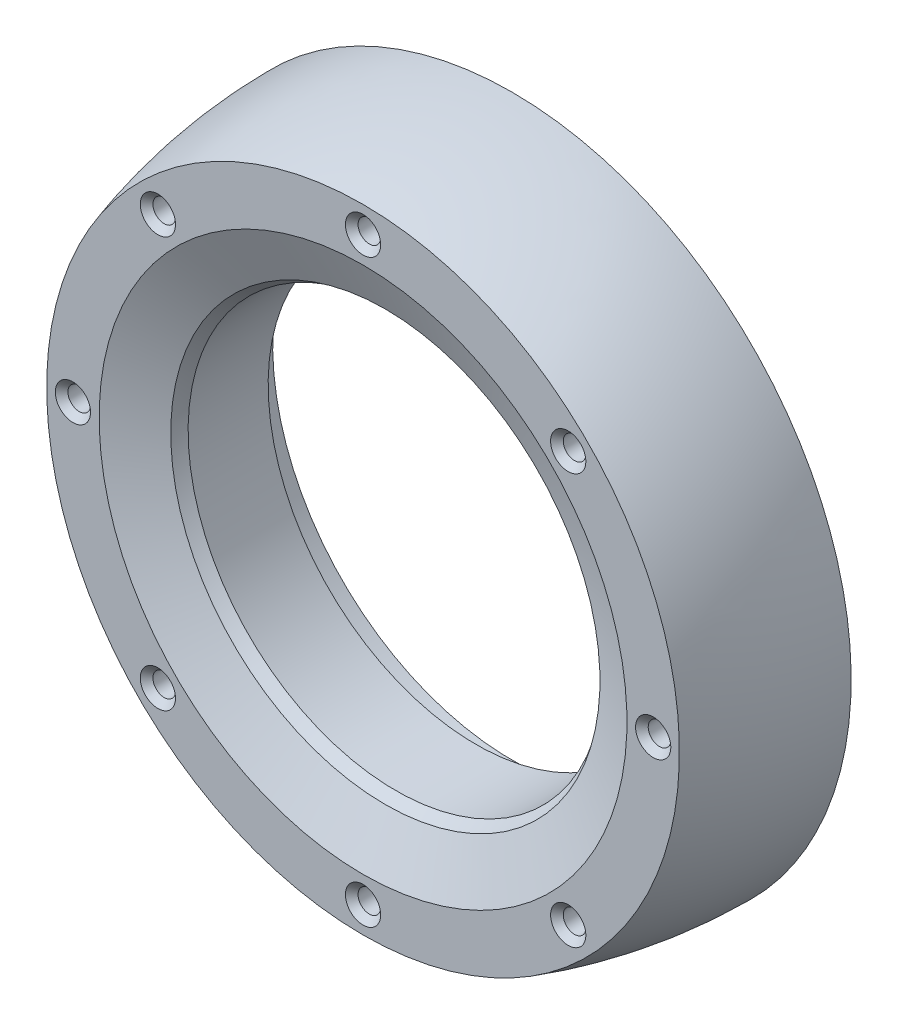
from build123d import *

# Parameters (mm, degrees)
FASE1_SIZE                                           = 4.290340475
SKIZZE11_R                                           = 22.5
SCHNITT_LINEAR_AUSTRAGEN3_DEPTH                      = 56.540525909
FORMSENKUNG_F_R_M3_SENKSCHRAUBE_MIT_INNE_D           = 1.6
FORMSENKUNG_F_R_M3_SENKSCHRAUBE_MIT_INNE_DEPTH       = 22
FORMSENKUNG_F_R_M3_SENKSCHRAUBE_MIT_INNE_CSINK_D     = 3.9
FORMSENKUNG_F_R_M3_SENKSCHRAUBE_MIT_INNE_CSINK_ANGLE = 90
FORMSENKUNG_F_R_M3_SENKSCHRAUBE_MIT_INNE_TIP         = 0.480688495
SKIZZE10_R                                           = 1.25
SCHNITT_LINEAR_AUSTRAGEN2_DEPTH                      = 56.540525909


with BuildPart() as part:
    # Skizze1 → Rotation (revolve)
    with BuildSketch(Plane(origin=(0, 0, 0), x_dir=(0, 0, -1), z_dir=(1, 0, 0))):
        with BuildLine():
            Line((0, 26), (0, 37.5))
            ThreePointArc((0, 37.5), (-8.344159634, 36.871453585), (-16.5, 35))
            Line((-16.5, 35), (-16.5, 24.905973721))
            ThreePointArc((-16.5, 24.905973721), (-12.407631733, 22.680062235), (-9.073139558, 19.426860442))
            Line((-9.073139558, 19.426860442), (-6, 22.5))
            Line((-6, 22.5), (-4, 22.5))
            Line((-4, 22.5), (-4, 26))
            Line((-4, 26), (0, 26))
        make_face()
    revolve(axis=Axis((0, 0, -11.01172812), (0, 0, 1)))

    # Fase1
    # the kernel refuses this chamfer: 4.290340475, 2.5 mm, written as the material it takes off along each edge
    with BuildSketch(Plane(origin=(0, 0, 16.5), x_dir=(0, 1, 0), z_dir=(1, 0, 0))) as fase1_piece_1:
        with BuildLine():
            Line((24.905973721 + FASE1_SIZE, 0), (23.741652955, -2.466620822))
            ThreePointArc((23.741652955, -2.466620822), (24.345172312, -1.316125117), (24.905973721, 0))
            Line((24.905973721, 0), (24.905973721 + FASE1_SIZE, 0))
        make_face()
    revolve(axis=Axis((0, 0, 16.5), (0, 0, 1)), mode=Mode.SUBTRACT)

    # Skizze11 → Schnitt-Linear austragen3 (cut, through all)
    with BuildSketch(Plane(origin=(0, 0, 0), x_dir=(-1, 0, 0), z_dir=(0, 0, -1))):
        with Locations(Location((0, 0, 0), (0, 0, 90))):
            Circle(SKIZZE11_R)
    extrude(amount=-SCHNITT_LINEAR_AUSTRAGEN3_DEPTH, mode=Mode.SUBTRACT)

    # Skizze5 → Druck-Toleranz I (revolve, cut)
    with BuildSketch(Plane(origin=(0, 0, 0), x_dir=(0, 0, -1), z_dir=(1, 0, 0))):
        Polygon((-4, 23), (-12.856349239, 23), (-12.856349239, 0), (0, 0), (0, 26.5), (-4, 26.5), align=None)
    revolve(axis=Axis((0, 0, -11.01172812), (0, 0, 1)), mode=Mode.SUBTRACT)

    # Formsenkung f_r M3 Senkschraube mit Inne
    with Locations(Plane(origin=(0, 0, 16.5), x_dir=(-1, 0, 0), z_dir=(0, 0, 1))):
        with Locations((0, 32.098157098), (22.696824548, 22.696824548), (32.098157098, 0), (22.696824548, -22.696824548), (0, -32.098157098), (-22.696824548, -22.696824548), (-32.098157098, 0), (-22.696824548, 22.696824548)):
            CounterSinkHole(FORMSENKUNG_F_R_M3_SENKSCHRAUBE_MIT_INNE_D / 2, FORMSENKUNG_F_R_M3_SENKSCHRAUBE_MIT_INNE_CSINK_D / 2, depth=FORMSENKUNG_F_R_M3_SENKSCHRAUBE_MIT_INNE_DEPTH, counter_sink_angle=FORMSENKUNG_F_R_M3_SENKSCHRAUBE_MIT_INNE_CSINK_ANGLE)
            with Locations((0, 0, -(FORMSENKUNG_F_R_M3_SENKSCHRAUBE_MIT_INNE_DEPTH + FORMSENKUNG_F_R_M3_SENKSCHRAUBE_MIT_INNE_TIP / 2))):  # 118° drill point
                Cone(0, FORMSENKUNG_F_R_M3_SENKSCHRAUBE_MIT_INNE_D / 2, FORMSENKUNG_F_R_M3_SENKSCHRAUBE_MIT_INNE_TIP, mode=Mode.SUBTRACT)

    # Skizze10 → Schnitt-Linear austragen2 (cut, through all)
    with BuildSketch(Plane(origin=(0, 0, 0), x_dir=(-1, 0, 0), z_dir=(0, 0, -1))):
        with Locations(Location((0, 32.098157098, 0), (0, 0, 90))):
            Circle(SKIZZE10_R)
        with Locations(Location((22.696824548, 22.696824548, 0), (0, 0, 90))):
            Circle(SKIZZE10_R)
        with Locations(Location((32.098157098, 0, 0), (0, 0, 90))):
            Circle(SKIZZE10_R)
        with Locations(Location((-22.696824548, 22.696824548, 0), (0, 0, 90))):
            Circle(SKIZZE10_R)
        with Locations(Location((-32.098157098, 0, 0), (0, 0, 90))):
            Circle(SKIZZE10_R)
        with Locations(Location((-22.696824548, -22.696824548, 0), (0, 0, 90))):
            Circle(SKIZZE10_R)
        with Locations(Location((0, -32.098157098, 0), (0, 0, 90))):
            Circle(SKIZZE10_R)
        with Locations(Location((22.696824548, -22.696824548, 0), (0, 0, 90))):
            Circle(SKIZZE10_R)
    extrude(amount=-SCHNITT_LINEAR_AUSTRAGEN2_DEPTH, mode=Mode.SUBTRACT)


solid = part.part
